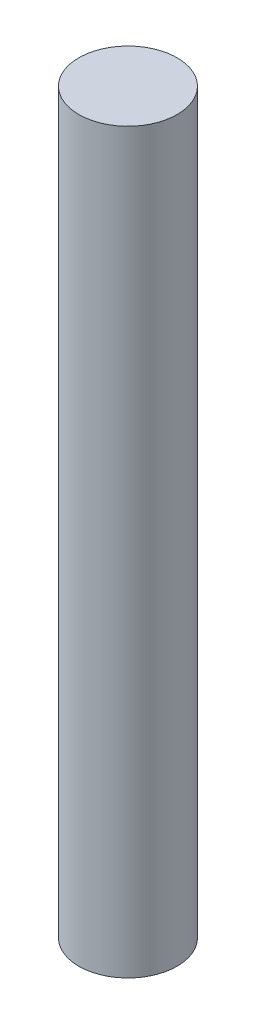
from build123d import *

# Parameters (mm, degrees)
SKETCH1_R           = 2
BOSS_EXTRUDE1_DEPTH = 30


with BuildPart() as part:
    # Sketch1 → Boss-Extrude1 (new body)
    with BuildSketch(Plane(origin=(0, 0, 0), x_dir=(1, 0, 0), z_dir=(0, 1, 0))):
        Circle(SKETCH1_R)
    extrude(amount=BOSS_EXTRUDE1_DEPTH)


solid = part.part
